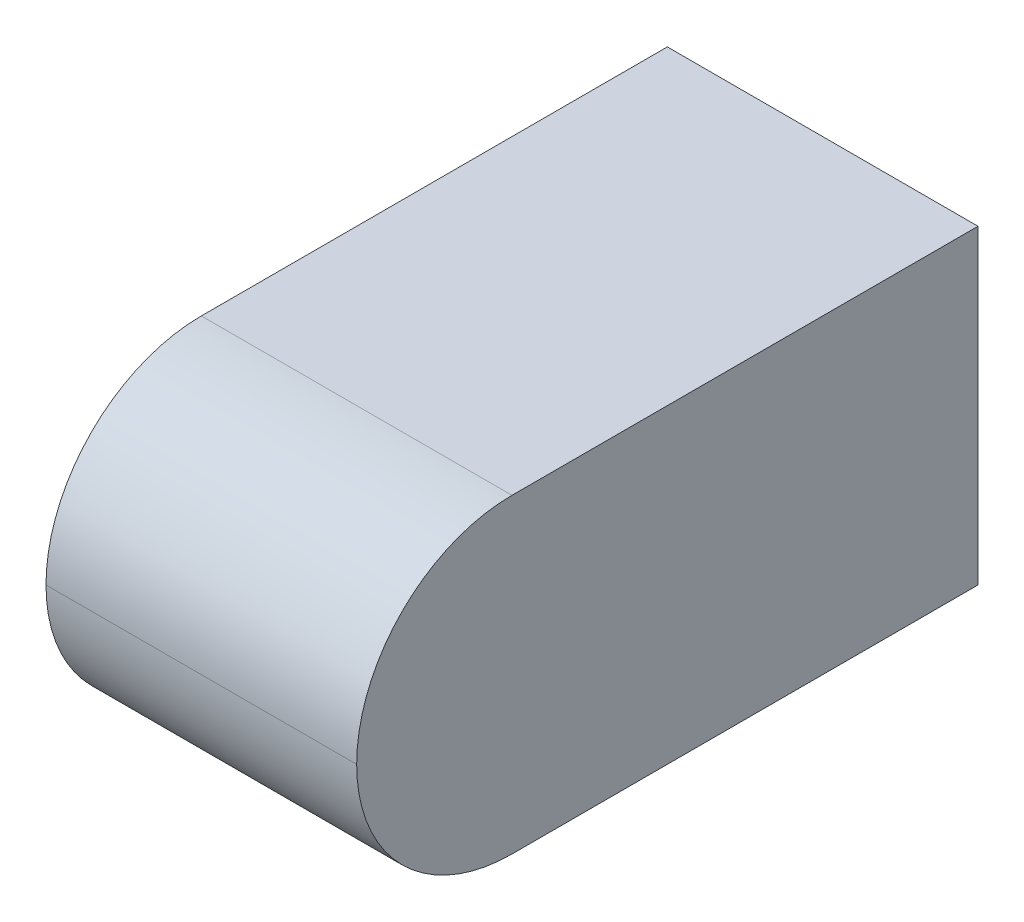
from build123d import *

# Parameters (mm, degrees)
SKETCH_1_W      = 15
SKETCH_1_H      = 15
SKETCH_1_R      = 5.5
EXTRUDE_1_DEPTH = 30
SKETCH_5_W      = 15
SKETCH_5_H      = 15
EXTRUDE_3_DEPTH = 20
FILLET_2_R      = 7.5


with BuildPart() as part:
    # ｽｹｯﾁ1 → ﾎﾞｽ - 押し出し1 (new body)
    with BuildSketch(Plane.XY):
        Rectangle(SKETCH_1_W, SKETCH_1_H)
        Circle(SKETCH_1_R, mode=Mode.SUBTRACT)
    extrude(amount=EXTRUDE_1_DEPTH)

    # ｽｹｯﾁ5 → ﾎﾞｽ - 押し出し3 (add)
    with BuildSketch(Plane.XY.offset(30)):
        Rectangle(SKETCH_5_W, SKETCH_5_H)
    extrude(amount=-EXTRUDE_3_DEPTH)

    # ﾌｨﾚｯﾄ2
    fillet_2_edges = [part.edges().sort_by_distance(p)[0] for p in [
        (0, -7.5, 30),
        (0, 7.5, 30),
    ]]
    fillet(fillet_2_edges, radius=FILLET_2_R - 0.0001)  # a hair under: the kernel refuses the full size


solid = part.part
